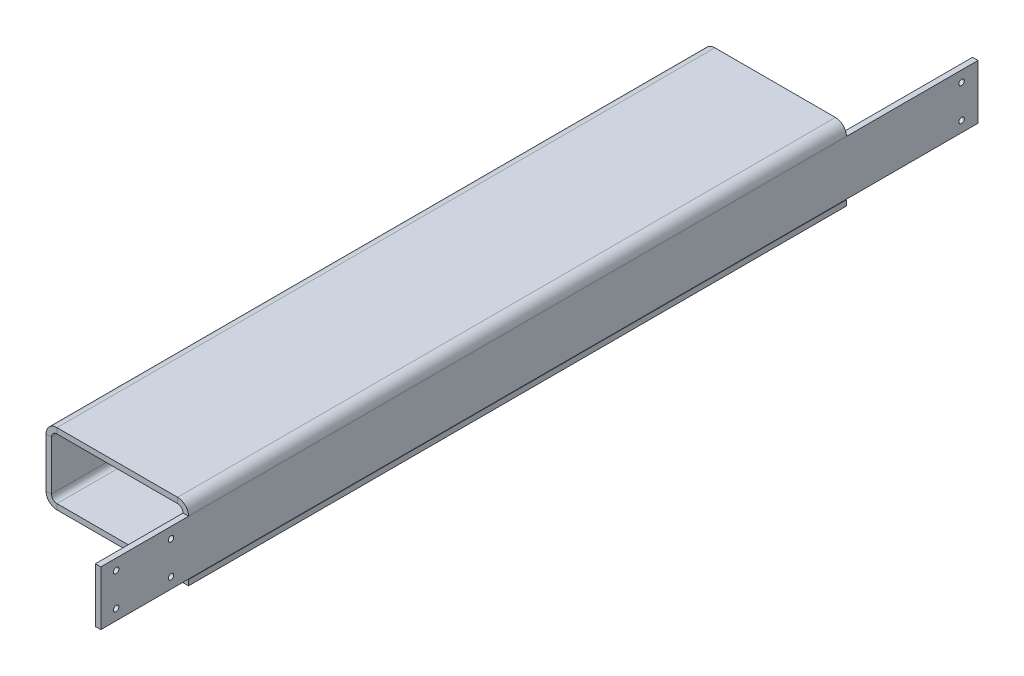
from build123d import *

# Parameters (mm, degrees)
SKETCH1_W                    = 79.375
SKETCH1_H                    = 381
BASE_FLANGE1_DEPTH           = 3.175
EDGE_FLANGE1_STRIP_W         = 19.05
EDGE_FLANGE1_STRIP_H         = 3.175
EDGE_FLANGE1_STRIP_CUT_DEPTH = 381
EDGE_FLANGE1_DEPTH           = 381
EDGE_FLANGE2_STRIP_W         = 19.05
EDGE_FLANGE2_STRIP_H         = 3.175
EDGE_FLANGE2_STRIP_CUT_DEPTH = 381
EDGE_FLANGE2_DEPTH           = 381
EDGE_FLANGE3_STRIP_W         = 19.05
EDGE_FLANGE3_STRIP_H         = 3.175
EDGE_FLANGE3_STRIP_CUT_DEPTH = 381
EDGE_FLANGE3_DEPTH           = 381
SKETCH24_W                   = 50.8
SKETCH24_H                   = 31.496
TAB3_DEPTH                   = 3.175
SKETCH27_W                   = 76.2
SKETCH27_H                   = 31.496
TAB4_DEPTH                   = 3.175
SKETCH30_R                   = 1.5875
CUT_EXTRUDE2_DEPTH           = 466.600516135
SKETCH31_R                   = 1.5875
CUT_EXTRUDE3_DEPTH           = 466.600516135


# Sheet-metal steps are written as plain solids
with BuildPart() as part:
    # Sketch1 → Base-Flange1 (new body)
    with BuildSketch(Plane(origin=(0, 0, 0), x_dir=(1, 0, 0), z_dir=(0, 1, 0))):
        with Locations((39.6875, 190.5)):
            Rectangle(SKETCH1_W, SKETCH1_H)
    extrude(amount=-BASE_FLANGE1_DEPTH)

    # Edge-Flange1 strip (across the edge) → Edge-Flange1 strip cut (cut)
    with BuildSketch(Plane.XY.offset(-381)):
        with Locations((-6.35, -1.5875)):
            Rectangle(EDGE_FLANGE1_STRIP_W, EDGE_FLANGE1_STRIP_H)
    extrude(amount=EDGE_FLANGE1_STRIP_CUT_DEPTH, mode=Mode.SUBTRACT)

    # Edge-Flange1 section (across the edge) → Edge-Flange1 (add)
    with BuildSketch(Plane.XY.offset(-381)):
        with BuildLine():
            Line((-3.175, 3.175), (-3.175, 34.925))
            Line((-3.175, 34.925), (0, 34.925))
            Line((0, 34.925), (0, 3.175))
            ThreePointArc((0, 3.175), (0.92993597, 0.92993597), (3.175, 0))
            Line((3.175, 0), (3.175, -3.175))
            ThreePointArc((3.175, -3.175), (-1.315128061, -1.315128061), (-3.175, 3.175))
        make_face()
    extrude(amount=EDGE_FLANGE1_DEPTH)

    # Edge-Flange2 strip (across the edge) → Edge-Flange2 strip cut (cut)
    with BuildSketch(Plane(origin=(0, 34.925, -381), x_dir=(0, -1, 0), z_dir=(0, 0, 1))):
        with Locations((-6.35, -1.5875)):
            Rectangle(EDGE_FLANGE2_STRIP_W, EDGE_FLANGE2_STRIP_H)
    extrude(amount=EDGE_FLANGE2_STRIP_CUT_DEPTH, mode=Mode.SUBTRACT)

    # Edge-Flange2 section (across the edge) → Edge-Flange2 (add)
    with BuildSketch(Plane(origin=(0, 34.925, -381), x_dir=(0, -1, 0), z_dir=(0, 0, 1))):
        with BuildLine():
            Line((-3.175, 3.175), (-3.175, 76.2))
            Line((-3.175, 76.2), (0, 76.2))
            Line((0, 76.2), (0, 3.175))
            ThreePointArc((0, 3.175), (0.92993597, 0.92993597), (3.175, 0))
            Line((3.175, 0), (3.175, -3.175))
            ThreePointArc((3.175, -3.175), (-1.315128061, -1.315128061), (-3.175, 3.175))
        make_face()
    extrude(amount=EDGE_FLANGE2_DEPTH)

    # Edge-Flange3 strip (across the edge) → Edge-Flange3 strip cut (cut)
    with BuildSketch(Plane(origin=(76.2, 34.925, -381), x_dir=(-1, 0, 0), z_dir=(0, 0, 1))):
        with Locations((-6.35, -1.5875)):
            Rectangle(EDGE_FLANGE3_STRIP_W, EDGE_FLANGE3_STRIP_H)
    extrude(amount=EDGE_FLANGE3_STRIP_CUT_DEPTH, mode=Mode.SUBTRACT)

    # Edge-Flange3 section (across the edge) → Edge-Flange3 (add)
    with BuildSketch(Plane(origin=(76.2, 34.925, -381), x_dir=(-1, 0, 0), z_dir=(0, 0, 1))):
        with BuildLine():
            Line((-3.175, 3.175), (-3.175, 34.671))
            Line((-3.175, 34.671), (0, 34.671))
            Line((0, 34.671), (0, 3.175))
            ThreePointArc((0, 3.175), (0.92993597, 0.92993597), (3.175, 0))
            Line((3.175, 0), (3.175, -3.175))
            ThreePointArc((3.175, -3.175), (-1.315128061, -1.315128061), (-3.175, 3.175))
        make_face()
    extrude(amount=EDGE_FLANGE3_DEPTH)

    # Sketch24 → Tab3 (add)
    with BuildSketch(Plane.ZY.offset(-76.2)):
        with Locations((25.4, 16.002)):
            Rectangle(SKETCH24_W, SKETCH24_H)
    extrude(amount=-TAB3_DEPTH)

    # Sketch27 → Tab4 (add)
    with BuildSketch(Plane.ZY.offset(-76.2)):
        with Locations((-419.1, 16.002)):
            Rectangle(SKETCH27_W, SKETCH27_H)
    extrude(amount=-TAB4_DEPTH)

    # Sketch30 → Cut-Extrude2 (cut, through all)
    with BuildSketch(Plane.ZY.offset(-76.2)):
        with Locations(Location((10.16, 25.527, 0), (0, 0, 270))):
            Circle(SKETCH30_R)
        with Locations(Location((41.91, 25.527, 0), (0, 0, 270))):
            Circle(SKETCH30_R)
        with Locations(Location((41.91, 6.477, 0), (0, 0, 270))):
            Circle(SKETCH30_R)
        with Locations(Location((10.16, 6.477, 0), (0, 0, 270))):
            Circle(SKETCH30_R)
    extrude(amount=-CUT_EXTRUDE2_DEPTH, mode=Mode.SUBTRACT)

    # Sketch31 → Cut-Extrude3 (cut, through all)
    with BuildSketch(Plane.ZY.offset(-76.2)):
        with Locations(Location((-447.675, 25.527, 0), (0, 0, 270))):
            Circle(SKETCH31_R)
        with Locations(Location((-447.675, 6.477, 0), (0, 0, 270))):
            Circle(SKETCH31_R)
    extrude(amount=-CUT_EXTRUDE3_DEPTH, mode=Mode.SUBTRACT)


solid = part.part
